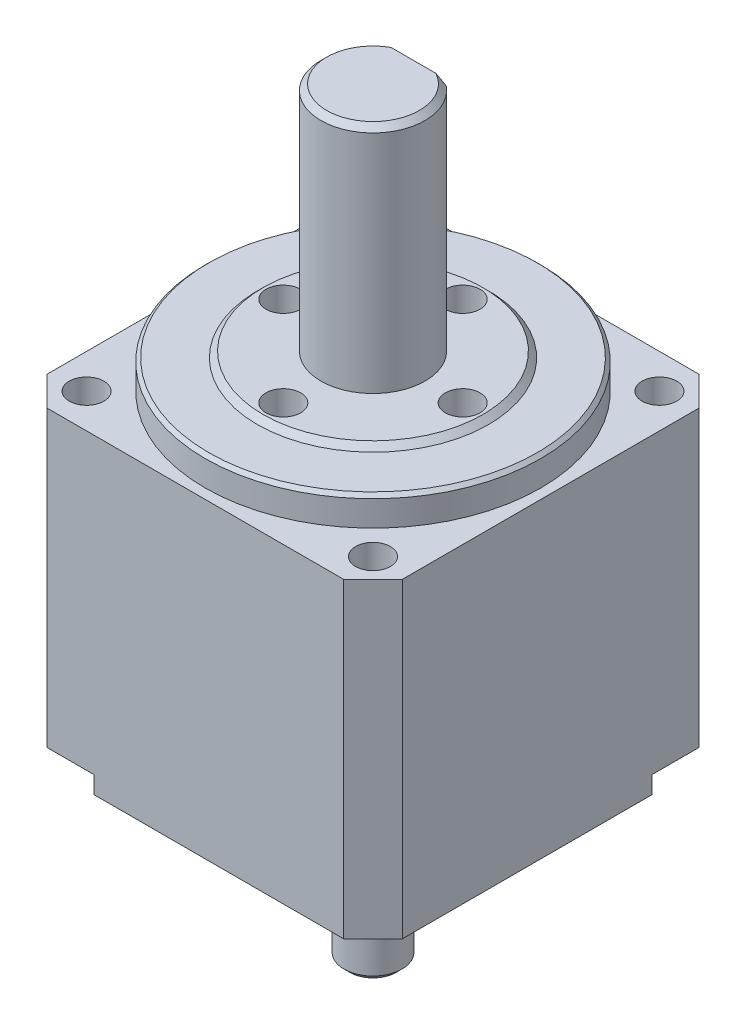
from build123d import *

# Parameters (mm, degrees)
SKETCH_1_W          = 30.7
SKETCH_1_H          = 30.7
EXTRUDE_1_DEPTH     = 26.9
SKETCH_2_R          = 14.5
EXTRUDE_2_DEPTH     = 2.5
SKETCH_3_R          = 9.5
EXTRUDE_3_DEPTH     = 0.5
CHAMFER_1_SIZE      = 0.5
CHAMFER_2_SIZE      = 0.3
SKETCH_4_R          = 4.5
EXTRUDE_4_DEPTH     = 20
SKETCH_5_R          = 8
EXTRUDE_5_DEPTH     = 2.6
SKETCH_6_R          = 2.5
EXTRUDE_6_DEPTH     = 13
CHAMFER_3_SIZE      = 0.5
CUT_EXTRUDE_1_DEPTH = 1.5
SKETCH_8_R          = 1.5
CUT_EXTRUDE_2_DEPTH = 6
SKETCH_9_R          = 1.25
CUT_EXTRUDE_3_DEPTH = 1.5
SKETCH_10_R         = 1.5
CUT_EXTRUDE_4_DEPTH = 4
SKETCH_11_R         = 1.25
CUT_EXTRUDE_5_DEPTH = 1.5
CHAMFER_4_SIZE      = 2.529
CHAMFER_5_SIZE      = 0.5
CUT_EXTRUDE_START   = -18
CUT_EXTRUDE_6_DEPTH = 18
CUT_EXTRUDE_START_2 = -11
CUT_EXTRUDE_7_DEPTH = 11


with BuildPart() as part:
    # 草图1 → 凸台-拉伸1 (new body)
    with BuildSketch(Plane(origin=(0, 0, 0), x_dir=(1, 0, 0), z_dir=(0, 1, 0))):
        Rectangle(SKETCH_1_W, SKETCH_1_H)
    extrude(amount=EXTRUDE_1_DEPTH)

    # 草图2 → 凸台-拉伸2 (add)
    with BuildSketch(Plane(origin=(0, 26.9, 0), x_dir=(1, 0, 0), z_dir=(0, 1, 0))):
        with Locations(Location((0, 0, 0), (0, 0, 270))):
            Circle(SKETCH_2_R)
    extrude(amount=EXTRUDE_2_DEPTH)

    # 草图3 → 凸台-拉伸3 (add)
    with BuildSketch(Plane(origin=(0, 29.4, 0), x_dir=(1, 0, 0), z_dir=(0, 1, 0))):
        with Locations(Location((0, 0, 0), (0, 0, 270))):
            Circle(SKETCH_3_R)
    extrude(amount=EXTRUDE_3_DEPTH)

    # 倒角1
    chamfer_1_edges = [part.edges().sort_by_distance(p)[0] for p in [
        (0, 29.4, -9.5),
    ]]
    chamfer(chamfer_1_edges, length=CHAMFER_1_SIZE - 0.0001)  # a hair under: the kernel refuses the full size

    # 倒角2
    chamfer_2_edges = [part.edges().sort_by_distance(p)[0] for p in [
        (0, 29.4, -14.5),
    ]]
    chamfer(chamfer_2_edges, length=CHAMFER_2_SIZE)

    # 草图4 → 凸台-拉伸4 (add)
    with BuildSketch(Plane(origin=(0, 29.9, 0), x_dir=(1, 0, 0), z_dir=(0, 1, 0))):
        with Locations(Location((0, 0, 0), (0, 0, 270))):
            Circle(SKETCH_4_R)
    extrude(amount=EXTRUDE_4_DEPTH)

    # 草图5 → 凸台-拉伸5 (add)
    with BuildSketch(Plane.XZ):
        with Locations(Location((0, 0, 0), (0, 0, 270))):
            Circle(SKETCH_5_R)
    extrude(amount=EXTRUDE_5_DEPTH)

    # 草图6 → 凸台-拉伸6 (add)
    with BuildSketch(Plane.XZ.offset(2.6)):
        with Locations(Location((0, 0, 0), (0, 0, 90))):
            Circle(SKETCH_6_R)
    extrude(amount=EXTRUDE_6_DEPTH)

    # 倒角3
    chamfer_3_edges = [part.edges().sort_by_distance(p)[0] for p in [
        (0, -2.6, 8),
        (0, -15.6, -2.5),
    ]]
    chamfer(chamfer_3_edges, length=CHAMFER_3_SIZE)

    # 草图7 → 切除-拉伸1 (cut)
    with BuildSketch(Plane.XZ):
        with BuildLine():
            Line((-15.35, 8.75), (-12, 8.75))
            ThreePointArc((-12, 8.75), (-9.701902961, 9.701902961), (-8.75, 12))
            Line((-8.75, 12), (-8.75, 15.35))
            Line((-8.75, 15.35), (-15.35, 15.35))
            Line((-15.35, 15.35), (-15.35, 8.75))
        make_face()
        with BuildLine():
            Line((15.35, -15.35), (15.35, -8.75))
            Line((15.35, -8.75), (12, -8.75))
            ThreePointArc((12, -8.75), (9.701902961, -9.701902961), (8.75, -12))
            Line((8.75, -12), (8.75, -15.35))
            Line((8.75, -15.35), (15.35, -15.35))
        make_face()
    extrude(amount=-CUT_EXTRUDE_1_DEPTH, mode=Mode.SUBTRACT)

    # 草图8 → 切除-拉伸2 (cut)
    with BuildSketch(Plane(origin=(0, 26.9, 0), x_dir=(1, 0, 0), z_dir=(0, 1, 0))):
        with Locations(Location((-12.374368671, 12.374368671, 0), (0, 0, 270))):
            Circle(SKETCH_8_R)
        with Locations(Location((12.374368671, 12.374368671, 0), (0, 0, 270))):
            Circle(SKETCH_8_R)
        with Locations(Location((12.374368671, -12.374368671, 0), (0, 0, 270))):
            Circle(SKETCH_8_R)
        with Locations(Location((-12.374368671, -12.374368671, 0), (0, 0, 270))):
            Circle(SKETCH_8_R)
    extrude(amount=-CUT_EXTRUDE_2_DEPTH, mode=Mode.SUBTRACT)

    # 草图9 → 切除-拉伸3 (cut)
    with BuildSketch(Plane(origin=(0, 20.9, 0), x_dir=(1, 0, 0), z_dir=(0, 1, 0))):
        with Locations(Location((12.374368671, -12.374368671, 0), (0, 0, 270))):
            Circle(SKETCH_9_R)
        with Locations(Location((12.374368671, 12.374368671, 0), (0, 0, 270))):
            Circle(SKETCH_9_R)
        with Locations(Location((-12.374368671, 12.374368671, 0), (0, 0, 270))):
            Circle(SKETCH_9_R)
        with Locations(Location((-12.374368671, -12.374368671, 0), (0, 0, 270))):
            Circle(SKETCH_9_R)
    extrude(amount=-CUT_EXTRUDE_3_DEPTH, mode=Mode.SUBTRACT)

    # 草图10 → 切除-拉伸4 (cut)
    with BuildSketch(Plane(origin=(0, 29.9, 0), x_dir=(1, 0, 0), z_dir=(0, 1, 0))):
        with Locations(Location((-7.75, 0, 0), (0, 0, 270))):
            Circle(SKETCH_10_R)
        with Locations(Location((0, 7.75, 0), (0, 0, 270))):
            Circle(SKETCH_10_R)
        with Locations(Location((7.75, 0, 0), (0, 0, 270))):
            Circle(SKETCH_10_R)
        with Locations(Location((0, -7.75, 0), (0, 0, 270))):
            Circle(SKETCH_10_R)
    extrude(amount=-CUT_EXTRUDE_4_DEPTH, mode=Mode.SUBTRACT)

    # 草图11 → 切除-拉伸5 (cut)
    with BuildSketch(Plane(origin=(0, 25.9, 0), x_dir=(1, 0, 0), z_dir=(0, 1, 0))):
        with Locations(Location((0, 7.75, 0), (0, 0, 270))):
            Circle(SKETCH_11_R)
        with Locations(Location((-7.75, 0, 0), (0, 0, 270))):
            Circle(SKETCH_11_R)
        with Locations(Location((7.75, 0, 0), (0, 0, 270))):
            Circle(SKETCH_11_R)
        with Locations(Location((0, -7.75, 0), (0, 0, 270))):
            Circle(SKETCH_11_R)
    extrude(amount=-CUT_EXTRUDE_5_DEPTH, mode=Mode.SUBTRACT)

    # 倒角4
    chamfer_4_edges = [part.edges().sort_by_distance(p)[0] for p in [
        (-15.35, 13.45, -15.35),
        (15.35, 14.2, -15.35),
        (15.35, 13.45, 15.35),
        (-15.35, 14.2, 15.35),
    ]]
    chamfer(chamfer_4_edges, length=CHAMFER_4_SIZE)

    # 倒角5
    chamfer_5_edges = [part.edges().sort_by_distance(p)[0] for p in [
        (0, 49.9, -4.5),
    ]]
    chamfer(chamfer_5_edges, length=CHAMFER_5_SIZE)

    # 草图12 → 切除-拉伸6 (cut)
    with BuildSketch(Plane(origin=(0, 49.9, 0), x_dir=(1, 0, 0), z_dir=(0, 1, 0)).offset(CUT_EXTRUDE_START)):
        with BuildLine():
            Line((-2.828427125, 3.5), (2.828427125, 3.5))
            ThreePointArc((2.828427125, 3.5), (0, 4.5), (-2.828427125, 3.5))
        make_face()
    extrude(amount=CUT_EXTRUDE_6_DEPTH, mode=Mode.SUBTRACT)

    # 草图13 → 切除-拉伸7 (cut)
    with BuildSketch(Plane.XZ.offset(15.6).offset(CUT_EXTRUDE_START_2)):
        with BuildLine():
            Line((-1.5, -2), (1.5, -2))
            ThreePointArc((1.5, -2), (0, -2.5), (-1.5, -2))
        make_face()
    extrude(amount=CUT_EXTRUDE_7_DEPTH, mode=Mode.SUBTRACT)


solid = part.part
